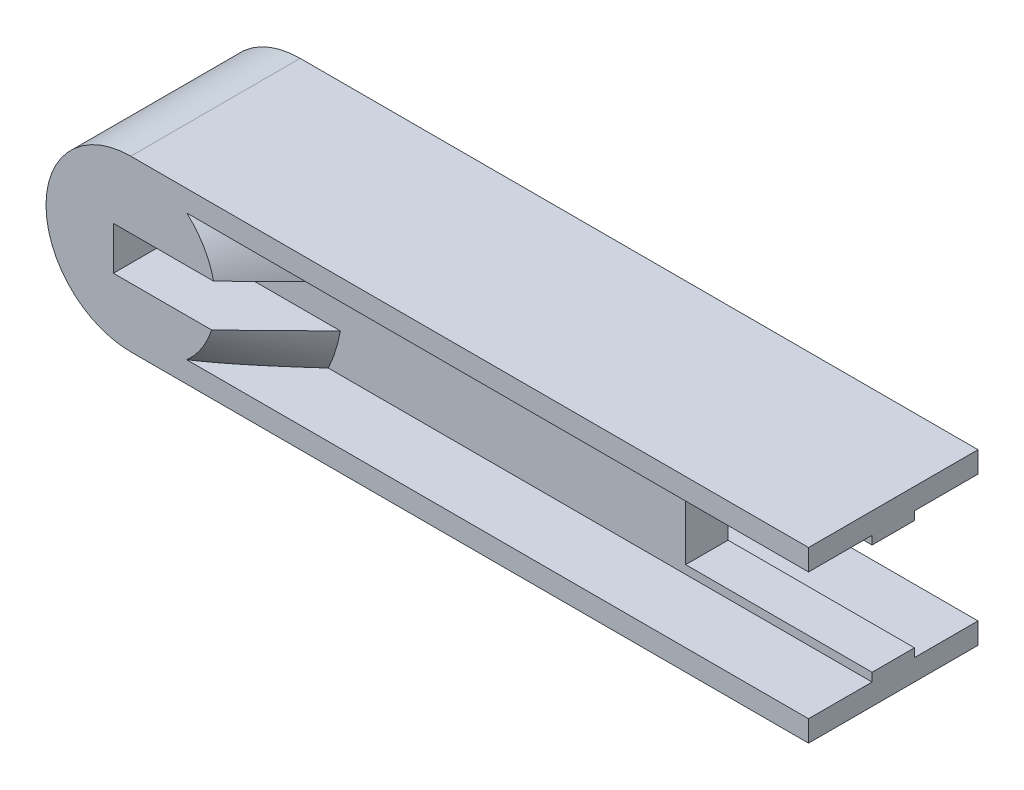
from build123d import *

# Parameters (mm, degrees)
SKETCH1_W           = 80
SKETCH1_H           = 20
BOSS_EXTRUDE1_DEPTH = 10
SKETCH2_W           = 80
SKETCH2_H           = 7.5
CUT_EXTRUDE1_DEPTH  = 7.5
SKETCH3_R           = 10
BOSS_EXTRUDE2_DEPTH = 10
CHAMFER1_SIZE       = 7.5
SKETCH8_W           = 24.4009661
SKETCH8_H           = 5.102020184
CUT_EXTRUDE2_DEPTH  = 7.5
SKETCH9_R           = 3.8
CUT_EXTRUDE3_DEPTH  = 5
CUT_EXTRUDE4_REACH  = 54.5
SKETCH10_W          = 22
SKETCH10_H          = 13


with BuildPart() as part:
    # Sketch1 → Boss-Extrude1 (new, symmetric)
    with BuildSketch(Plane(origin=(0, 0, 0), x_dir=(1, 0, 0), z_dir=(0, 1, 0))):
        Rectangle(SKETCH1_W, SKETCH1_H)
    extrude(amount=BOSS_EXTRUDE1_DEPTH, both=True)

    # Sketch2 → Cut-Extrude1 (cut, symmetric)
    with BuildSketch(Plane(origin=(0, 0, 0), x_dir=(1, 0, 0), z_dir=(0, 1, 0))):
        with Locations((0, 6.25)):
            Rectangle(SKETCH2_W, SKETCH2_H)
        with Locations((0, -6.25)):
            Rectangle(SKETCH2_W, SKETCH2_H)
    extrude(amount=CUT_EXTRUDE1_DEPTH, both=True, mode=Mode.SUBTRACT)

    # Sketch3 → Boss-Extrude2 (add, symmetric)
    with BuildSketch(Plane.XY):
        with Locations((-40, 0)):
            Circle(SKETCH3_R)
    extrude(amount=BOSS_EXTRUDE2_DEPTH, both=True)

    # Chamfer1
    chamfer1_edges = [part.edges().sort_by_distance(p)[0] for p in [
        (-30, 0, -2.5),
        (-30, 0, 2.5),
    ]]
    chamfer(chamfer1_edges, length=CHAMFER1_SIZE - 0.0001)  # a hair under: the kernel refuses the full size

    # Sketch8 → Cut-Extrude2 (cut)
    with BuildSketch(Plane.XY.offset(10)):
        with Locations((-29.842461096, -0.437762938)):
            Rectangle(SKETCH8_W, SKETCH8_H)
    extrude(amount=-CUT_EXTRUDE2_DEPTH, mode=Mode.SUBTRACT)

    # Sketch9 → Cut-Extrude3 (cut)
    with BuildSketch(Plane(origin=(0, 0, -10), x_dir=(-1, 0, 0), z_dir=(0, 0, -1))):
        with Locations((40, 0)):
            Circle(SKETCH9_R)
    extrude(amount=-CUT_EXTRUDE3_DEPTH, mode=Mode.SUBTRACT)

    # Sketch10 → Cut-Extrude4 (cut, up to next)
    with BuildSketch(Plane(origin=(0, 0, -2.5), x_dir=(-1, 0, 0), z_dir=(0, 0, -1)), mode=Mode.PRIVATE) as cut_extrude4_sk1:
        with Locations((-29, 0)):
            Rectangle(SKETCH10_W, SKETCH10_H)
    cut_extrude4_tool1 = extrude(cut_extrude4_sk1.sketch, amount=-CUT_EXTRUDE4_REACH, mode=Mode.PRIVATE) & part.part
    add(cut_extrude4_tool1.solids().sort_by_distance((29, 0, -2.5))[0], mode=Mode.SUBTRACT)


solid = part.part
